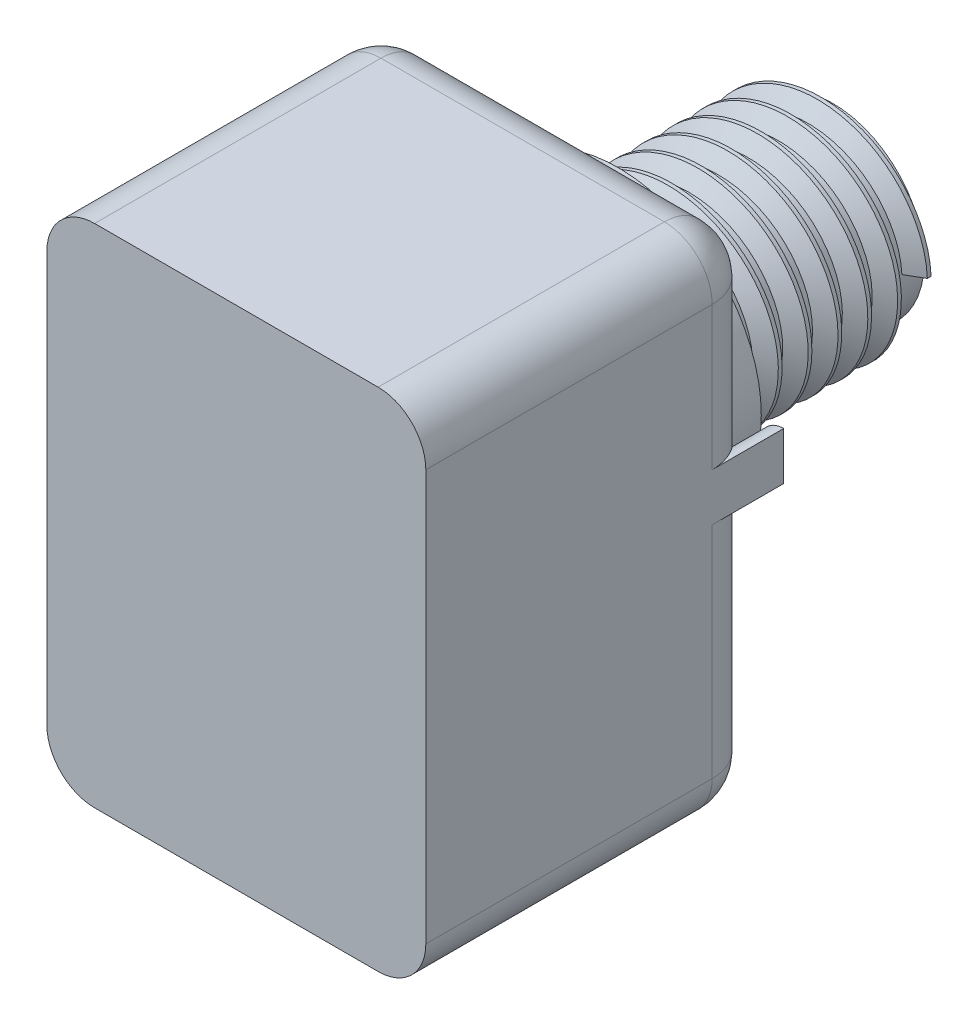
from build123d import *

# Parameters (mm, degrees)
SZKIC1_R                        = 3
DODANIE_WYCI_GNI_CIE1_DEPTH     = 13
SZKIC2_R                        = 3.83
DODANIE_WYCI_GNI_CIE2_DEPTH     = 9
GWINT1_PITCH                    = 1.25
SZKIC6_R                        = 6
DODANIE_WYCI_GNI_CIE3_DEPTH     = 2
SZKIC8_W                        = 15.88
SZKIC8_H                        = 21.21
DODANIE_WYCI_GNI_CIE4_DEPTH     = 14
ZAOKR_GLENIE1_R                 = 2
WYTNIJ_WYCI_GNI_CIE1_DEPTH      = 9
DODANIE_WYCI_GNI_CIE6_OUTLINE_W = 1
DODANIE_WYCI_GNI_CIE6_OUTLINE_H = 2
DODANIE_WYCI_GNI_CIE6_ANGLE     = 180
DODANIE_WYCI_GNI_CIE7_START     = 24
DODANIE_WYCI_GNI_CIE7_DEPTH     = 1
SZKIC11_R                       = 9.097435871
WYTNIJ_WYCI_GNI_CIE2_DEPTH      = 29.933159292


# Read off the part's stored shape, not the designer's step: Dodanie-wyciągnięcie6
with BuildPart() as part:
    # Szkic1 → Dodanie-wyciągnięcie1 (new body)
    with BuildSketch(Plane.XY):
        with Locations(Location((0, 0, 0), (0, 0, 180))):
            Circle(SZKIC1_R)
    extrude(amount=DODANIE_WYCI_GNI_CIE1_DEPTH)

    # Szkic2 → Dodanie-wyciągnięcie2 (add)
    with BuildSketch(Plane.XY.offset(13)):
        Circle(SZKIC2_R)
    extrude(amount=DODANIE_WYCI_GNI_CIE2_DEPTH)

    # Gwint1: the profile of Profil gwintu1 profile screwed along a right-hand helix of 8 turns, 8 arcs to a turn; built about Z, then put on its axis
    gwint1_z = Axis((0, 0, 0), (0, 0, 1))
    gwint1_corners = [(3.8297, 0, -0.000173205), (4.506582344, 0, 0.390624998), (4.506582344, 0, 0.546874998), (3.8297, 0, 0.937673202)]
    with BuildLine(mode=Mode.PRIVATE) as gwint1_profile:
        Line(gwint1_corners[0], gwint1_corners[1])
        Line(gwint1_corners[1], gwint1_corners[2])
        Line(gwint1_corners[2], gwint1_corners[3])
        Line(gwint1_corners[3], gwint1_corners[0])
    gwint1_cap = Face(gwint1_profile.wire())
    gwint1_turn_angles = [0, 22.5, 45, 67.5, 90, 112.5, 135, 157.5, 180, 202.5, 225, 247.5, 270, 292.5, 315, 337.5, 360]
    gwint1_turn_weights = [1, 0.9238795325112867, 1, 0.9238795325112867, 1, 0.9238795325112867, 1, 0.9238795325112867, 1, 0.9238795325112867, 1, 0.9238795325112867, 1, 0.9238795325112867, 1, 0.9238795325112867, 1]
    gwint1_turn_rails = [Edge.make_bspline([Vector(p[0], p[1], 0).rotate(gwint1_z, gwint1_turn_angles[k]) / gwint1_turn_weights[k] + Vector(0, 0, p[2] + GWINT1_PITCH * gwint1_turn_angles[k] / 360) for k in range(17)], [0, 0, 0, 1, 1, 2, 2, 3, 3, 4, 4, 5, 5, 6, 6, 7, 7, 8, 8, 8], 2, gwint1_turn_weights) for p in gwint1_corners]
    gwint1_turn_sides = [Face.make_surface_from_curves(gwint1_turn_rails[p[0]], gwint1_turn_rails[p[1]]) for p in [(0, 1), (1, 2), (2, 3), (3, 0)]]
    gwint1 = Plane(origin=(0, 0, 13), x_dir=(1, 0, 0), z_dir=(0, 0, 1)) * Solid(Shell([*[p.moved(Location((0, 0, GWINT1_PITCH * i))) for i in range(8) for p in gwint1_turn_sides], gwint1_cap, gwint1_cap.rotate(gwint1_z, 2880).moved(Location((0, 0, GWINT1_PITCH * 2880 / 360)))]))
    add(gwint1)

    # Szkic6 → Dodanie-wyciągnięcie3 (add)
    with BuildSketch(Plane.XY.offset(22)):
        Circle(SZKIC6_R)
    extrude(amount=DODANIE_WYCI_GNI_CIE3_DEPTH)

    # Szkic8 → Dodanie-wyciągnięcie4 (add)
    with BuildSketch(Plane.XY.offset(24)):
        with Locations((0, -1.605)):
            Rectangle(SZKIC8_W, SZKIC8_H)
    extrude(amount=DODANIE_WYCI_GNI_CIE4_DEPTH)

    # Zaokrąglenie1
    zaokr_glenie1_edges = [part.edges().sort_by_distance(p)[0] for p in [
        (-7.94, -1.605, 24),
        (-7.94, 9, 31),
        (0, -12.21, 24),
        (-7.94, -12.21, 31),
        (7.94, -1.605, 24),
        (7.94, -12.21, 31),
        (0, 9, 24),
        (7.94, 9, 31),
    ]]
    fillet(zaokr_glenie1_edges, radius=ZAOKR_GLENIE1_R)

    # Szkic9 → Wytnij-wyciągnięcie1 (cut)
    with BuildSketch(Plane(origin=(0, 0, 0), x_dir=(-1, 0, 0), z_dir=(0, 0, -1))):
        Polygon((-1.596370884, -2.54), (1.596370884, -2.54), (8.034501067, -6.687500384), (-7.848069709, -6.190255995), align=None)
    extrude(amount=-WYTNIJ_WYCI_GNI_CIE1_DEPTH, mode=Mode.SUBTRACT)

    # Dodanie-wyciągnięcie6 outline → Dodanie-wyciągnięcie6 (revolve)
    with BuildSketch(Plane.YZ.offset(7.94)):
        with Locations((0.5, 25)):
            Rectangle(DODANIE_WYCI_GNI_CIE6_OUTLINE_W, DODANIE_WYCI_GNI_CIE6_OUTLINE_H)
    revolve(axis=Axis((7.94, 0, 0), (0, 0, 1)), revolution_arc=DODANIE_WYCI_GNI_CIE6_ANGLE)

    # Szkic10<2> → Dodanie-wyciągnięcie7 (add)
    with BuildSketch(Plane.XY.offset(DODANIE_WYCI_GNI_CIE7_START)):
        with BuildLine():
            Line((7.94, 0), (7.94, 1))
            ThreePointArc((7.94, 1), (6.94, 0), (7.94, -1))
            Line((7.94, -1), (7.94, 0))
        make_face()
    extrude(amount=-DODANIE_WYCI_GNI_CIE7_DEPTH)

    # Szkic11 → Wytnij-wyciągnięcie2 (cut, through all)
    with BuildSketch(Plane(origin=(0, 0, 13), x_dir=(-1, 0, 0), z_dir=(0, 0, -1))):
        Circle(SZKIC11_R)
    extrude(amount=WYTNIJ_WYCI_GNI_CIE2_DEPTH, mode=Mode.SUBTRACT)


solid = part.part
